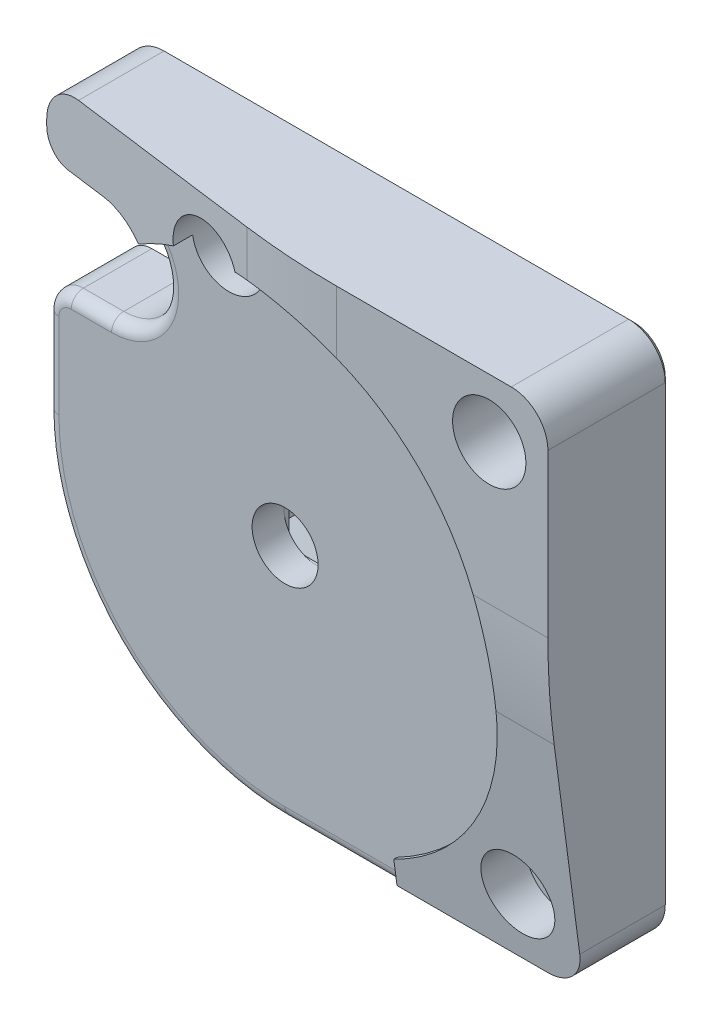
from build123d import *
from OCP.BRepFilletAPI import BRepFilletAPI_MakeChamfer

# Parameters (mm, degrees)
CUT_EXTRUDE1_START         = -8.138931699
CUT_EXTRUDE1_DEPTH         = 7.263304995
CUT_EXTRUDE1_START_2       = -0.875626704
CUT_EXTRUDE1_2_DEPTH       = 2.736695005
CUT_EXTRUDE1_START_3       = 57.3134639
CUT_EXTRUDE1_3_DEPTH       = 15.345083288
CUT_EXTRUDE1_START_4       = -177.745546793
CUT_EXTRUDE1_4_OUTLINE_W   = 26
CUT_EXTRUDE1_4_OUTLINE_H   = 8.646582531
CUT_EXTRUDE1_4_DEPTH       = 2.974334584
CUT_EXTRUDE2_START         = -3.263295925
SKETCH2_R                  = 3
CUT_EXTRUDE2_DEPTH         = 3.263295925
CUT_EXTRUDE3_START         = -0.263304995
CUT_EXTRUDE3_DEPTH         = 0.263304995
CUT_EXTRUDE4_DEPTH         = 4
SKETCH5_W                  = 5.4
SKETCH5_H                  = 5.4
CUT_EXTRUDE5_DEPTH         = 0.4
CUT_EXTRUDE6_REACH         = 79.957
CUT_EXTRUDE7_REACH         = 79.957
CUT_EXTRUDE8_REACH         = 79.972
SKETCH12_R                 = 1.7
CUT_EXTRUDE9_DEPTH         = 3.66863822
SKETCH13_R                 = 2.5
CUT_EXTRUDE10_DEPTH        = 0.33137085
CUT_EXTRUDE10_DRAFT        = -67.5
F_5_4_5_4_DIAMETER_HOLE1_D = 5.4
FILLET1_R                  = 2
FILLET2_R                  = 3
FILLET3_R                  = 19.5
FILLET4_R                  = 60
CHAMFER1_SIZE              = 0.06862915
CHAMFER1_SIZE2             = 0.126810134
CHAMFER2_SIZE              = 0.4
FILLET6_R                  = 1


with BuildPart() as part:
    # Cut-Extrude1: read off the stored shape, not the designer's step
    # Cut-Extrude1 outline → Cut-Extrude1 (new body)
    with BuildSketch(Plane.XY.offset(181.191207123).offset(CUT_EXTRUDE1_START)):
        with BuildLine():
            Line((33.958547188, 13.146582531), (28.658547188, 13.146582531))
            Line((28.658547188, 13.146582531), (28.658547188, -15.353417469))
            Line((28.658547188, -15.353417469), (72.658547188, -15.353417469))
            Line((72.658547188, -15.353417469), (72.658547188, 27.646582531))
            Line((72.658547188, 27.646582531), (28.658547188, 27.646582531))
            Line((28.658547188, 27.646582531), (28.658547188, 22.146582531))
            Line((28.658547188, 22.146582531), (33.958547188, 22.146582531))
            ThreePointArc((33.958547188, 22.146582531), (38.458547188, 17.646582531), (33.958547188, 13.146582531))
        make_face()
    extrude(amount=CUT_EXTRUDE1_DEPTH)

    # Cut-Extrude1 2 outline → Cut-Extrude1 2 (add)
    with BuildSketch(Plane.XY.offset(181.191207123).offset(CUT_EXTRUDE1_START_2)):
        with BuildLine():
            Line((57.3134639, -13.353417469), (57.3134639, -15.353417469))
            Line((57.3134639, -15.353417469), (72.658547188, -15.353417469))
            Line((72.658547188, -15.353417469), (72.658547188, 27.646582531))
            Line((72.658547188, 27.646582531), (28.658547188, 27.646582531))
            Line((28.658547188, 27.646582531), (28.658547188, 22.146582531))
            Line((28.658547188, 22.146582531), (33.958547188, 22.146582531))
            ThreePointArc((33.958547188, 22.146582531), (35.793572578, 21.755436607), (37.309592323, 20.649996673))
            ThreePointArc((37.309592323, 20.649996673), (38.910429164, 21.597508381), (40.593311101, 22.390203415))
            ThreePointArc((40.593311101, 22.390203415), (42.841906799, 25.758729522), (46.396632901, 23.817834602))
            ThreePointArc((46.396632901, 23.817834602), (67.108207247, 9.711911241), (57.3134639, -13.353417469))
        make_face()
    extrude(amount=CUT_EXTRUDE1_2_DEPTH)

    # Cut-Extrude1 3 outline → Cut-Extrude1 3 (cut)
    with BuildSketch(Plane.YZ.offset(CUT_EXTRUDE1_START_3)):
        Polygon((-15.353417469, 183.052275424), (-15.353417469, 180.052275424), (7.433844869, 183.052275424), align=None)
    extrude(amount=CUT_EXTRUDE1_3_DEPTH, mode=Mode.SUBTRACT)

    # Cut-Extrude1 4 outline → Cut-Extrude1 4 (cut)
    with BuildSketch(Plane(origin=(0, 0, 0), x_dir=(0.9914448613737413, 0, 0.1305261922205761), z_dir=(0.13052619222057607, 0, -0.9914448613737414)).offset(CUT_EXTRUDE1_START_4)):
        with Locations((63, -23.323291265)):
            Rectangle(CUT_EXTRUDE1_4_OUTLINE_W, CUT_EXTRUDE1_4_OUTLINE_H)
    extrude(amount=CUT_EXTRUDE1_4_DEPTH, mode=Mode.SUBTRACT)

    # Sketch2 → Cut-Extrude2 (cut)
    with BuildSketch(Plane.XY.offset(180.31558042).offset(CUT_EXTRUDE2_START)):
        with Locations(Location((43.558547999, 22.845582531, 0), (0, 0, 180))):
            Circle(SKETCH2_R)
    extrude(amount=CUT_EXTRUDE2_DEPTH, mode=Mode.SUBTRACT)

    # Sketch3 → Cut-Extrude3 (cut)
    with BuildSketch(Plane.XY.offset(180.31558042).offset(CUT_EXTRUDE3_START)):
        with BuildLine():
            Line((28.658547188, -15.353417469), (57.3134639, -15.353417469))
            Line((57.3134639, -15.353417469), (57.3134639, -13.353417469))
            ThreePointArc((57.3134639, -13.353417469), (67.108207247, 9.711911241), (46.396632901, 23.817834602))
            ThreePointArc((46.396632901, 23.817834602), (44.275189199, 19.93243554), (40.593311101, 22.390203415))
            ThreePointArc((40.593311101, 22.390203415), (38.910429164, 21.597508381), (37.309592322, 20.649996673))
            ThreePointArc((37.309592322, 20.649996673), (38.067401264, 15.811557141), (33.958547188, 13.146582531))
            Line((33.958547188, 13.146582531), (28.658547188, 13.146582531))
            Line((28.658547188, 13.146582531), (28.658547188, -15.353417469))
        make_face()
    extrude(amount=CUT_EXTRUDE3_DEPTH, mode=Mode.SUBTRACT)

    # Sketch4 → Cut-Extrude4 (cut)
    with BuildSketch(Plane(origin=(0, 0, 173.052275424), x_dir=(-1, 0, 0), z_dir=(0, 0, -1))):
        Polygon((-43.958547188, 6.571453662), (-48.158547188, 8.996324792), (-50.858547188, 7.437479065), (-50.858547188, 0.855685997), (-48.158547188, -0.70315973), (-43.958547188, 1.7217114), align=None)
    extrude(amount=-CUT_EXTRUDE4_DEPTH, mode=Mode.SUBTRACT)

    # Sketch5 → Cut-Extrude5 (cut)
    with BuildSketch(Plane(origin=(0, 0, 177.052275424), x_dir=(-1, 0, 0), z_dir=(0, 0, -1))):
        with Locations((-48.158547188, 4.146582531)):
            Rectangle(SKETCH5_W, SKETCH5_H)
    extrude(amount=-CUT_EXTRUDE5_DEPTH, mode=Mode.SUBTRACT)

    # Sketch7 → Cut-Extrude6 (cut, up to next)
    with BuildSketch(Plane.XY.offset(177.252275424), mode=Mode.PRIVATE) as cut_extrude6_sk1:
        Polygon((48.158547188, 8.996324792), (45.458547188, 7.437479065), (45.458547188, 6.846582531), (50.858547188, 6.846582531), (50.858547188, 7.437479065), align=None)
    cut_extrude6_tool1 = extrude(cut_extrude6_sk1.sketch, amount=-CUT_EXTRUDE6_REACH, mode=Mode.PRIVATE) & part.part
    add(cut_extrude6_tool1.solids().sort_by_distance((48.158547, 7.60563, 177.252275))[0], mode=Mode.SUBTRACT)

    # Sketch9 → Cut-Extrude7 (cut, up to next)
    with BuildSketch(Plane.XY.offset(177.252275424), mode=Mode.PRIVATE) as cut_extrude7_sk1:
        Polygon((48.158547188, -0.70315973), (50.858547188, 0.855685997), (50.858547188, 1.446582531), (45.458547188, 1.446582531), (45.458547188, 0.855685997), align=None)
    cut_extrude7_tool1 = extrude(cut_extrude7_sk1.sketch, amount=-CUT_EXTRUDE7_REACH, mode=Mode.PRIVATE) & part.part
    add(cut_extrude7_tool1.solids().sort_by_distance((48.158547, 0.687535, 177.252275))[0], mode=Mode.SUBTRACT)

    # Sketch11 → Cut-Extrude8 (cut, up to next)
    with BuildSketch(Plane.XY.offset(177.052275424), mode=Mode.PRIVATE) as cut_extrude8_sk1:
        Polygon((50.858547188, 7.437479065), (50.858547188, 0.855685997), (52.358547188, 1.7217114), (52.358547188, 6.571453662), align=None)
    cut_extrude8_tool1 = extrude(cut_extrude8_sk1.sketch, amount=-CUT_EXTRUDE8_REACH, mode=Mode.PRIVATE) & part.part
    add(cut_extrude8_tool1.solids().sort_by_distance((51.570668, 4.146583, 177.052275))[0], mode=Mode.SUBTRACT)

    # Sketch12 → Cut-Extrude9 (cut)
    with BuildSketch(Plane.XY.offset(177.052284495)):
        with Locations(Location((43.558547999, 22.845582531, 0), (0, 0, 180))):
            Circle(SKETCH12_R)
    extrude(amount=-CUT_EXTRUDE9_DEPTH, mode=Mode.SUBTRACT)


with BuildPart() as cut_extrude10_tool:
    # Sketch13 → Cut-Extrude10 (with draft: the straight prism first)
    with BuildSketch(Plane(origin=(0, 0, 173.052275424), x_dir=(-1, 0, 0), z_dir=(0, 0, -1))):
        with Locations((-43.558547999, 22.845582531)):
            Circle(SKETCH13_R)
    extrude(amount=-CUT_EXTRUDE10_DEPTH)
    # Cut-Extrude10: the draft: its side faces are tilted about the plane it starts from
    cut_extrude10_sides = [cut_extrude10_tool.faces().sort_by_distance(p)[0] for p in [
        (46.058547999, 22.845582531, 173.217960849),
    ]]
    draft(cut_extrude10_sides, Plane(origin=(0, 0, 173.052275424), x_dir=(-1, 0, 0), z_dir=(0, 0, -1)), CUT_EXTRUDE10_DRAFT)


with BuildPart() as part_1:
    add(part.part)

    # Cut-Extrude10: cut by cut_extrude10_tool
    add(cut_extrude10_tool.part, mode=Mode.SUBTRACT)

    # Ø5.4 (5.4) Diameter Hole1 (through all)
    with Locations(Plane.XY.offset(180.052275424)):
        with Locations((48.158547188, 4.146582531)):
            Hole(F_5_4_5_4_DIAMETER_HOLE1_D / 2)

    # Sketch16 → CBORE for M3 Hex Head Machine Screw1 (revolve, cut)
    with BuildSketch(Plane(origin=(67.858547188, -10.35389299, 181.105432802), x_dir=(0, -1, 0), z_dir=(1, 0, 0))):
        Polygon((0, 0), (0, 8.053157377), (2.5, 8.053157377), (1.7, 7.721786527), (1.7, 4.053148307), (3, 4.053148307), (3, 0), align=None)
    revolve(axis=Axis((67.858547188, -10.35389299, 187.455432802), (0, 0, -1)), mode=Mode.SUBTRACT)

    # Sketch18 → CBORE for M3 Hex Head Machine Screw2 (revolve, cut)
    with BuildSketch(Plane(origin=(67.858547188, 22.845582531, 183.052275424), x_dir=(0, -1, 0), z_dir=(1, 0, 0))):
        Polygon((0, 0), (0, 10), (2.5, 10), (1.7, 9.66862915), (1.7, 5.99999093), (3, 5.99999093), (3, 0), align=None)
    revolve(axis=Axis((67.858547188, 22.845582531, 189.402275424), (0, 0, -1)), mode=Mode.SUBTRACT)

    # Fillet1
    fillet1_edges = [part_1.edges().sort_by_distance(p)[0] for p in [
        (28.658547188, 22.146582531, 176.552275424),
        (28.658547188, 13.146582531, 176.552275424),
    ]]
    fillet(fillet1_edges, radius=FILLET1_R)

    # Fillet2
    fillet2_edges = [part_1.edges().sort_by_distance(p)[0] for p in [
        (72.658547188, 27.646582531, 178.052275424),
        (72.658547188, -15.353417469, 176.552275424),
        (28.658547188, 27.646582531, 176.552275424),
    ]]
    fillet(fillet2_edges, radius=FILLET2_R)

    # Fillet3
    fillet3_edges = [part_1.edges().sort_by_distance(p)[0] for p in [
        (28.658547188, -15.353417469, 176.552275424),
    ]]
    fillet(fillet3_edges, radius=FILLET3_R)

    # Fillet4
    fillet4_edges = [part_1.edges().sort_by_distance(p)[0] for p in [
        (70.145800475, 7.433844869, 183.052275424),
        (51.445809525, 25.633835818, 183.052275424),
    ]]
    fillet(fillet4_edges, radius=FILLET4_R)

    # Chamfer1: one chamfer whose edges measure the first distance from different faces: ONE call of the kernel's chamfer builder (chamfer() names one face for all edges)
    chamfer1_edges_1 = [part_1.edges().sort_by_distance(p)[0] for p in [
        (45.258547999, 22.845582531, 173.383646274),
    ]]
    chamfer1_side_1 = [part_1.faces().sort_by_distance(p)[0] for p in [
        (45.658547999, 22.845582531, 173.217960849),
    ]]
    chamfer1_edges_2 = [part_1.edges().sort_by_distance(p)[0] for p in [
        (67.858547188, -8.65389299, 173.383646274),
    ]]
    chamfer1_side_2 = [part_1.faces().sort_by_distance(p)[0] for p in [
        (67.858547188, -8.65389299, 175.217965384),
    ]]
    chamfer1_edges_3 = [part_1.edges().sort_by_distance(p)[0] for p in [
        (67.858547188, 24.545582531, 173.383646274),
    ]]
    chamfer1_side_3 = [part_1.faces().sort_by_distance(p)[0] for p in [
        (67.858547188, 24.545582531, 175.217965384),
    ]]
    chamfer1 = BRepFilletAPI_MakeChamfer(part_1.part.solid().wrapped)
    for e in chamfer1_edges_1:
        chamfer1.Add(CHAMFER1_SIZE, CHAMFER1_SIZE2, e.wrapped, chamfer1_side_1[0].wrapped)  # the first distance lies on this face
    for e in chamfer1_edges_2:
        chamfer1.Add(CHAMFER1_SIZE, CHAMFER1_SIZE2, e.wrapped, chamfer1_side_2[0].wrapped)  # the first distance lies on this face
    for e in chamfer1_edges_3:
        chamfer1.Add(CHAMFER1_SIZE, CHAMFER1_SIZE2, e.wrapped, chamfer1_side_3[0].wrapped)  # the first distance lies on this face
    add(Compound.cast(chamfer1.Shape()), mode=Mode.REPLACE)

    # Chamfer2
    chamfer2_edges = [part_1.edges().sort_by_distance(p)[0] for p in [
        (32.308547188, 13.146582531, 173.052275424),
        (38.458547188, 17.646582531, 173.052275424),
        (43.958547188, 4.146582531, 173.052275424),
        (46.058547188, 7.783889227, 173.052275424),
        (49.508547188, 8.216901929, 173.052275424),
        (49.508547188, 0.076263133, 173.052275424),
        (46.058547188, 0.509275835, 173.052275424),
        (52.358547188, 4.146582531, 173.052275424),
        (32.308547188, 22.146582531, 173.052275424),
        (28.658547188, 7.646582531, 173.052275424),
        (29.244333626, 12.560796093, 173.052275424),
        (29.244333626, 22.732368969, 173.052275424),
        (50.658547188, 27.646582531, 173.052275424),
        (28.658547188, 24.396582531, 173.052275424),
        (72.658547188, 6.146582531, 173.052275424),
        (29.537226844, 26.767902875, 173.052275424),
        (71.779867531, -14.474737813, 173.052275424),
        (71.779867531, 26.767902875, 173.052275424),
        (58.908547188, -15.353417469, 173.052275424),
        (34.369964955, -9.641999702, 173.052275424),
    ]]
    chamfer(chamfer2_edges, length=CHAMFER2_SIZE)

    # Fillet6
    fillet6_edges = [part_1.edges().sort_by_distance(p)[0] for p in [
        (32.308547188, 13.146582531, 180.052275424),
        (38.067401264, 15.811557141, 180.052275424),
        (28.658547188, 7.646582531, 180.052275424),
        (29.244333626, 12.560796093, 180.052275424),
        (52.736005544, -15.353417469, 180.052275424),
        (34.369964955, -9.641999702, 180.052275424),
    ]]
    fillet(fillet6_edges, radius=FILLET6_R)


solid = part_1.part
